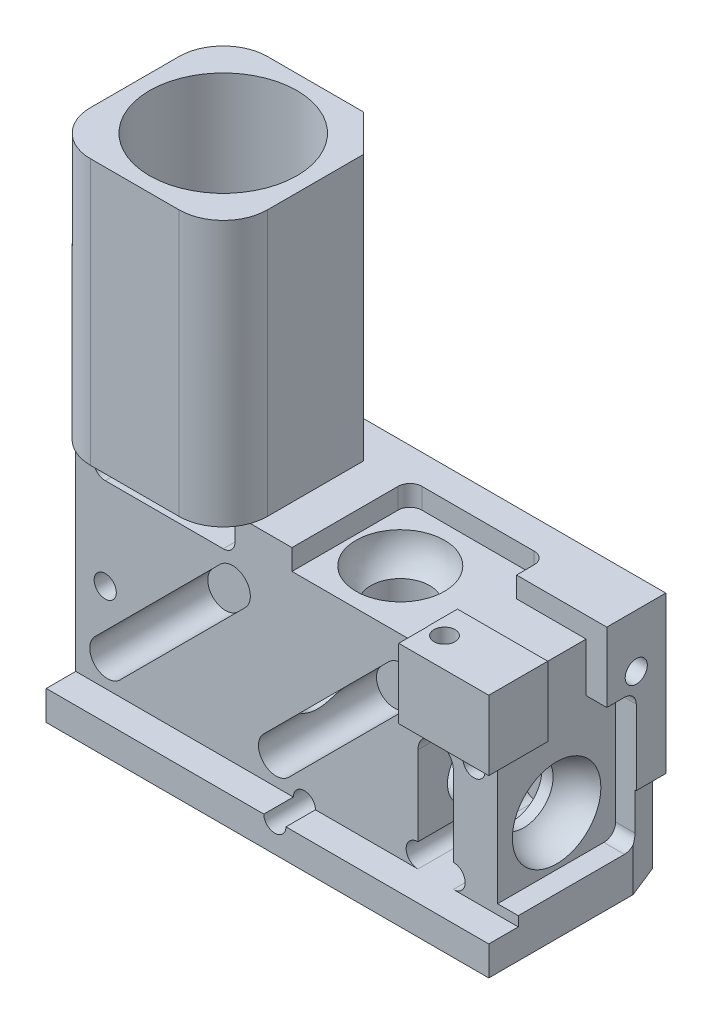
from build123d import *

# Parameters (mm, degrees)
SKETCH1_W                        = 15
SKETCH1_H                        = 6
MAIN_BODY_EXT_DEPTH              = 8.3
EMISSION_PATH_EXT_DEPTH          = 9
SKETCH3_R                        = 1.25
EMISSION_AND_GRIN_CUT_DEPTH      = 20.092931
SKETCH4_R                        = 1
DRUM_LENS_CUT_DEPTH              = 13
SKETCH41_R                       = 1
ADDTL_LIGHT_SOURCE_DEPTH         = 5
SKETCH5_W                        = 15
SKETCH5_H                        = 7.3
FILTERSET_CUT1_DEPTH             = 1
FILTERSET_CUT2_DEPTH             = 4
SKETCH10_R                       = 2.5
EMISSION_LENS_CUT_DEPTH          = 8.5
SKETCH15_R                       = 0.795
MAGNETS_CUT_DEPTH                = 0.9
SCREW_HOLES_CUT_DEPTH            = 20.507434
SCREW_HOLES_CUT_DEPTH_BACK       = 3
SKETCH18_R                       = 0.375
EXTERNAL_FILLET_1_R              = 1.5
CUT_EXTRUDE8_DEPTH               = 14.011149
CUT_EXTRUDE8_DEPTH_BACK          = 4
SKETCH28_R                       = 1.5
CUT_EXTRUDE9_DEPTH               = 3
CUT_EXTRUDE_ORIGINAL_LIGHT_DEPTH = 0.7
CUT_EXTRUDE_ADDTL_LIGHT_DEPTH    = 0.7
SKETCH29_R                       = 0.375
CUT_EXTRUDE11_DEPTH              = 2.5
SKETCH32_W                       = 2
SKETCH32_H                       = 2.36
CUT_EXTRUDE14_DEPTH              = 0.7
SKETCH45_W                       = 2.36
SKETCH45_H                       = 2
CUT_EXTRUDE19_DEPTH              = 0.7
CUT_EXTRUDE16_DEPTH              = 9
CUT_EXTRUDE17_REACH              = 13.945
SKETCH37_R                       = 2
BOSS_EXTRUDE2_DEPTH              = 1
SKETCH51_R                       = 0.356741
ADD_L_SCREW_HOLE_DEPTH           = 2


with BuildPart() as part:
    # Sketch1 → Main Body Ext (new body)
    with BuildSketch(Plane(origin=(0, 0, 0), x_dir=(1, 0, 0), z_dir=(0, 1, 0))):
        Rectangle(SKETCH1_W, SKETCH1_H)
    extrude(amount=MAIN_BODY_EXT_DEPTH)

    # Sketch8 → Emission Path Ext (add)
    with BuildSketch(Plane(origin=(0, 8.3, 0), x_dir=(1, 0, 0), z_dir=(0, 1, 0))):
        Polygon((-2.75, 3), (-1.5, 1.75), (-1.5, -3), (-7.5, -3), (-7.5, 3), align=None)
    extrude(amount=EMISSION_PATH_EXT_DEPTH)

    # Sketch3 → Emission and Grin Cut (cut, through all)
    with BuildSketch(Plane.XZ):
        with Locations(Location((-4.5, 0, 0), (0, 0, 270))):
            Circle(SKETCH3_R)
    extrude(amount=-EMISSION_AND_GRIN_CUT_DEPTH, mode=Mode.SUBTRACT)

    # Sketch4 → Drum Lens Cut (cut)
    with BuildSketch(Plane(origin=(7.5, 0, 0), x_dir=(0, 0, -1), z_dir=(1, 0, 0))):
        with Locations((0, 3)):
            Circle(SKETCH4_R)
    extrude(amount=-DRUM_LENS_CUT_DEPTH, mode=Mode.SUBTRACT)

    # Sketch41 → Addtl Light Source (cut)
    with BuildSketch(Plane(origin=(0, 8.3, 0), x_dir=(1, 0, 0), z_dir=(0, 1, 0))):
        with Locations(Location((1.5, 0, 0), (0, 0, 270))):
            Circle(SKETCH41_R)
    extrude(amount=-ADDTL_LIGHT_SOURCE_DEPTH, mode=Mode.SUBTRACT)

    # Sketch5 → FilterSet Cut1 (cut)
    with BuildSketch(Plane.XY.offset(3)):
        with Locations((0, 4.65)):
            Rectangle(SKETCH5_W, SKETCH5_H)
    extrude(amount=-FILTERSET_CUT1_DEPTH, mode=Mode.SUBTRACT)

    # Sketch6 → FilterSet Cut2 (cut)
    with BuildSketch(Plane.XY.offset(2)):
        with BuildLine():
            Line((5.3, 4.5), (5.3, 1.8))
            ThreePointArc((5.3, 1.8), (5.7, 1.4), (5.3, 1))
            Line((5.3, 1), (4.1, 1))
            ThreePointArc((4.1, 1), (3.7, 1.4), (4.1, 1.8))
            Line((4.1, 1.8), (4.1, 4.5))
            ThreePointArc((4.1, 4.5), (4.7, 5.1), (5.3, 4.5))
        make_face()
        with BuildLine():
            Line((-6.9, 7.9), (-6.9, 7.5))
            ThreePointArc((-6.9, 7.5), (-6.782843, 7.217157), (-6.5, 7.1))
            Line((-6.5, 7.1), (-2.5, 7.1))
            ThreePointArc((-2.5, 7.1), (-2.217157, 7.217157), (-2.1, 7.5))
            Line((-2.1, 7.5), (-2.1, 7.9))
            ThreePointArc((-2.1, 7.9), (-2.217157, 8.182843), (-2.5, 8.3))
            Line((-2.5, 8.3), (-6.5, 8.3))
            ThreePointArc((-6.5, 8.3), (-6.782843, 8.182843), (-6.9, 7.9))
        make_face()
        with BuildLine():
            Line((-2.605887, 6.591169), (-6.848528, 2.348528))
            ThreePointArc((-6.848528, 2.348528), (-6.848528, 1.5), (-6, 1.5))
            Line((-6, 1.5), (-1.757359, 5.742641))
            ThreePointArc((-1.757359, 5.742641), (-1.757359, 6.591169), (-2.605887, 6.591169))
        make_face()
        with BuildLine():
            Line((3.112092, 6.591169), (-1.130548, 2.348528))
            ThreePointArc((-1.130548, 2.348528), (-1.130548, 1.5), (-0.28202, 1.5))
            Line((-0.28202, 1.5), (3.96062, 5.742641))
            ThreePointArc((3.96062, 5.742641), (3.96062, 6.591169), (3.112092, 6.591169))
        make_face()
    extrude(amount=-FILTERSET_CUT2_DEPTH, mode=Mode.SUBTRACT)

    # Sketch10 → Emission Lens Cut (cut)
    with BuildSketch(Plane(origin=(0, 17.3, 0), x_dir=(1, 0, 0), z_dir=(0, 1, 0))):
        with Locations(Location((-4.5, 0, 0), (0, 0, 270))):
            Circle(SKETCH10_R)
    extrude(amount=-EMISSION_LENS_CUT_DEPTH, mode=Mode.SUBTRACT)

    # Sketch15 → Magnets Cut (cut)
    with BuildSketch(Plane.XZ):
        with Locations(Location((-6.25, -1.875, 0), (0, 0, 270))):
            Circle(SKETCH15_R)
        with Locations(Location((-6.25, 1.875, 0), (0, 0, 270))):
            Circle(SKETCH15_R)
        with Locations(Location((2.5, 0, 0), (0, 0, 270))):
            Circle(SKETCH15_R)
    extrude(amount=-MAGNETS_CUT_DEPTH, mode=Mode.SUBTRACT)

    # Sketch18 → Screw Holes Cut (cut, two sides: drawn at the far end of the back side and taken through both)
    with BuildSketch(Plane.XY.offset(2).offset(-SCREW_HOLES_CUT_DEPTH_BACK)):
        with Locations(Location((-6.5, 4, 0), (0, 0, 180))):
            Circle(SKETCH18_R)
        with Locations(Location((6, 5, 0), (0, 0, 180))):
            Circle(SKETCH18_R)
        with Locations((0.25, 1)):
            Circle(SKETCH18_R)
    extrude(amount=SCREW_HOLES_CUT_DEPTH + SCREW_HOLES_CUT_DEPTH_BACK, mode=Mode.SUBTRACT)

    # External Fillet 1
    # the kernel refuses this fillet: 1.5 mm, written as the material it takes off along each edge
    with BuildSketch(Plane(origin=(-7.5, -3.75, -3), x_dir=(1, 0, 0), z_dir=(0, 1, 0))) as external_fillet_1_piece_1:
        with BuildLine():
            CenterArc((EXTERNAL_FILLET_1_R, -EXTERNAL_FILLET_1_R), EXTERNAL_FILLET_1_R, 90, 90)
            Line((0, -EXTERNAL_FILLET_1_R), (0, 0))
            Line((0, 0), (EXTERNAL_FILLET_1_R, 0))
        make_face()
    extrude(amount=24.8, mode=Mode.SUBTRACT)
    with BuildSketch(Plane(origin=(-1.5, 8.3, 3), x_dir=(0, 0, -1), z_dir=(0, 1, 0))) as external_fillet_1_piece_2:
        with BuildLine():
            CenterArc((EXTERNAL_FILLET_1_R, EXTERNAL_FILLET_1_R), EXTERNAL_FILLET_1_R, 180, 90)
            Line((0, EXTERNAL_FILLET_1_R), (0, 0))
            Line((0, 0), (EXTERNAL_FILLET_1_R, 0))
        make_face()
    extrude(amount=12.75, mode=Mode.SUBTRACT)

    # Sketch28 → Cut-Extrude8 (cut, two sides: drawn at the far end of the back side and taken through both)
    with BuildSketch(Plane(origin=(0, 7.1, 0), x_dir=(1, 0, 0), z_dir=(0, 1, 0)).offset(-CUT_EXTRUDE8_DEPTH_BACK)):
        with Locations(Location((-4.5, 0, 0), (0, 0, 180))):
            Circle(SKETCH28_R)
    extrude(amount=CUT_EXTRUDE8_DEPTH + CUT_EXTRUDE8_DEPTH_BACK, mode=Mode.SUBTRACT)

    # Sketch14 → Cut-Extrude9 (cut)
    with BuildSketch(Plane.XZ):
        Polygon((7.5, -3), (7.5, -1.891585), (7.056634, -3), align=None)
    extrude(amount=-CUT_EXTRUDE9_DEPTH, mode=Mode.SUBTRACT)

    # Sketch12 → Cut-Extrude Original Light (cut)
    with BuildSketch(Plane(origin=(7.5, 0, 0), x_dir=(0, 0, -1), z_dir=(1, 0, 0))):
        with BuildLine():
            Line((1.6, 5.94), (-1.6, 5.94))
            Line((-1.6, 5.94), (-2, 5.94))
            Line((-2, 5.94), (-2, 1.33))
            Line((-2, 1.33), (1.6, 1.33))
            ThreePointArc((1.6, 1.33), (1.882843, 1.447157), (2, 1.73))
            Line((2, 1.73), (2, 5.54))
            ThreePointArc((2, 5.54), (1.882843, 5.822843), (1.6, 5.94))
        make_face()
    extrude(amount=-CUT_EXTRUDE_ORIGINAL_LIGHT_DEPTH, mode=Mode.SUBTRACT)

    # Sketch44 → Cut-Extrude Addtl Light (cut)
    with BuildSketch(Plane(origin=(0, 8.3, 0), x_dir=(1, 0, 0), z_dir=(0, 1, 0))):
        with BuildLine():
            Line((-0.17, -2), (4.44, -2))
            Line((4.44, -2), (4.44, 1.6))
            ThreePointArc((4.44, 1.6), (4.322843, 1.882843), (4.04, 2))
            Line((4.04, 2), (0.23, 2))
            ThreePointArc((0.23, 2), (-0.052843, 1.882843), (-0.17, 1.6))
            Line((-0.17, 1.6), (-0.17, -2))
        make_face()
    extrude(amount=-CUT_EXTRUDE_ADDTL_LIGHT_DEPTH, mode=Mode.SUBTRACT)

    # Sketch29 → Cut-Extrude11 (cut)
    with BuildSketch(Plane(origin=(7.5, 0, 0), x_dir=(0, 0, -1), z_dir=(1, 0, 0))):
        with Locations((2, 6.5)):
            Circle(SKETCH29_R)
    extrude(amount=-CUT_EXTRUDE11_DEPTH, mode=Mode.SUBTRACT)

    # Sketch32 → Cut-Extrude14 (cut)
    with BuildSketch(Plane(origin=(7.5, 0, 0), x_dir=(0, 0, -1), z_dir=(1, 0, 0))):
        with Locations((0, 7.12)):
            Rectangle(SKETCH32_W, SKETCH32_H)
    extrude(amount=-CUT_EXTRUDE14_DEPTH, mode=Mode.SUBTRACT)

    # Sketch45 → Cut-Extrude19 (cut)
    with BuildSketch(Plane(origin=(0, 8.3, 0), x_dir=(1, 0, 0), z_dir=(0, 1, 0))):
        with Locations((5.62, 0)):
            Rectangle(SKETCH45_W, SKETCH45_H)
    extrude(amount=-CUT_EXTRUDE19_DEPTH, mode=Mode.SUBTRACT)

    # Sketch33 → Cut-Revolve1 (revolve, cut)
    with BuildSketch(Plane.XY, mode=Mode.PRIVATE) as cut_revolve1_sk:
        with BuildLine():
            Line((6.8, 3), (5.3, 3))
            ThreePointArc((5.3, 3), (5.73934, 4.06066), (6.8, 4.5))
            Line((6.8, 4.5), (6.8, 3))
        make_face()
    revolve(cut_revolve1_sk.sketch.rotate(Axis((6.8, 3, 0), (-1, 0, 0)), 84.26086), axis=Axis((6.8, 3, 0), (-1, 0, 0)), mode=Mode.SUBTRACT)

    # Sketch47 → Cut-Revolve2 (revolve, cut)
    with BuildSketch(Plane(origin=(1.5, 0, 0), x_dir=(0, 0, -1), z_dir=(1, 0, 0))):
        with BuildLine():
            Line((-1.5, 7.6), (0, 7.6))
            Line((0, 7.6), (0, 6.137287))
            ThreePointArc((0, 6.137287), (-1.04756, 6.563498), (-1.5, 7.6))
        make_face()
    revolve(axis=Axis((1.5, 7.6, 0), (0, -1, 0)), mode=Mode.SUBTRACT)

    # Sketch36 → Cut-Extrude16 (cut)
    with BuildSketch(Plane(origin=(0, 17.3, 0), x_dir=(1, 0, 0), z_dir=(0, 1, 0))):
        with BuildLine():
            Line((-7.5, -1.5), (-7.5, -3))
            Line((-7.5, -3), (-6, -3))
            ThreePointArc((-6, -3), (-7.06066, -2.56066), (-7.5, -1.5))
        make_face()
    extrude(amount=-CUT_EXTRUDE16_DEPTH, mode=Mode.SUBTRACT)

    # Sketch37 → Cut-Extrude17 (cut, up to next)
    with BuildSketch(Plane(origin=(0, 8.8, 0), x_dir=(1, 0, 0), z_dir=(0, 1, 0)), mode=Mode.PRIVATE) as cut_extrude17_sk1:
        with Locations(Location((-4.5, 0, 0), (0, 0, 180))):
            Circle(SKETCH37_R)
    cut_extrude17_tool1 = extrude(cut_extrude17_sk1.sketch, amount=-CUT_EXTRUDE17_REACH, mode=Mode.PRIVATE) & part.part
    add(cut_extrude17_tool1.solids().sort_by_distance((-4.5, 8.8, 0))[0], mode=Mode.SUBTRACT)

    # Sketch49 → Boss-Extrude2 (add)
    with BuildSketch(Plane.XY.offset(2)):
        Polygon((7.5, 5.94), (7.5, 8.3), (4.448399, 8.3), (4.448399, 5.94), (7.025856, 5.94), (7.026388, 5.94), align=None)
    extrude(amount=BOSS_EXTRUDE2_DEPTH)

    # Sketch51 → Add'l Screw Hole (cut)
    with BuildSketch(Plane(origin=(0, 8.3, 0), x_dir=(1, 0, 0), z_dir=(0, 1, 0))):
        with Locations(Location((5, -2, 0), (0, 0, 270))):
            Circle(SKETCH51_R)
    extrude(amount=-ADD_L_SCREW_HOLE_DEPTH, mode=Mode.SUBTRACT)


solid = part.part
